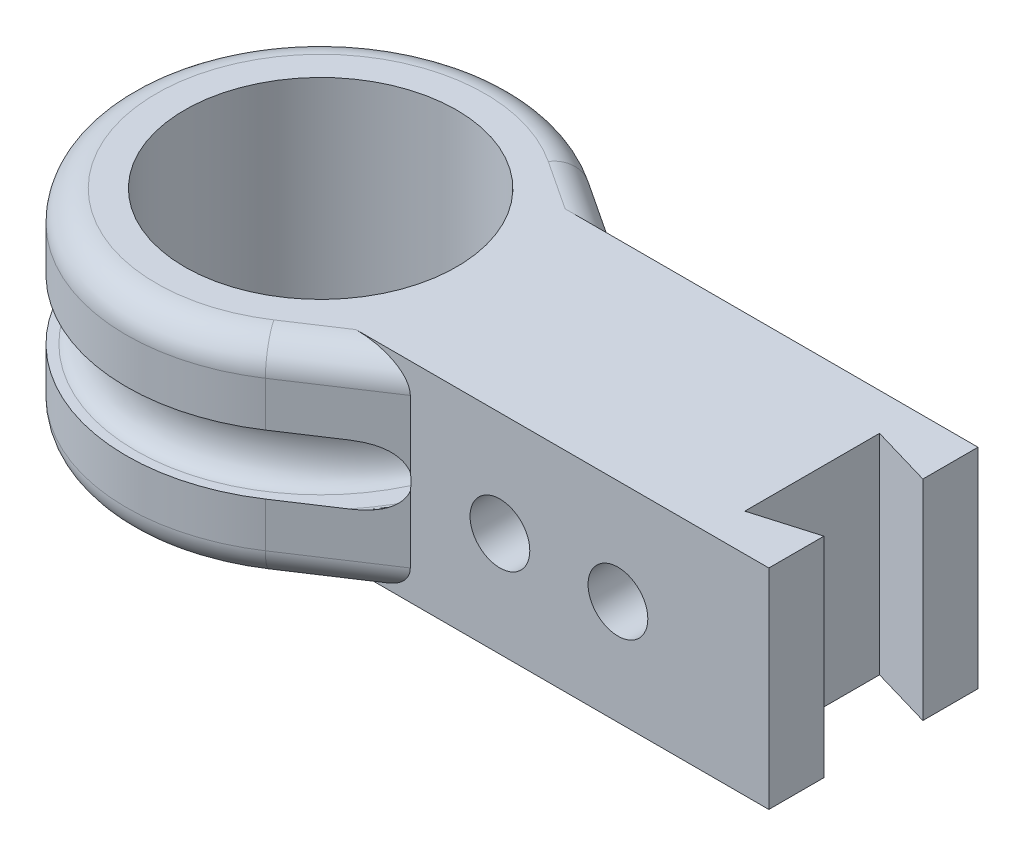
from build123d import *

# Parameters (mm, degrees)
SKETCH1_R           = 4.55
BOSS_EXTRUDE2_DEPTH = 7
CUT_EXTRUDE1_REACH  = 24.164
SKETCH3_R           = 1
FILLET4_R           = 1


with BuildPart() as part:
    # Sketch1 → Boss-Extrude2 (new body)
    with BuildSketch(Plane(origin=(0, 0, 0), x_dir=(1, 0, 0), z_dir=(0, 1, 0))):
        with BuildLine():
            Line((18.5, 3.5), (6.5, 3.5))
            Line((6.5, 3.5), (3.577981651, 5.426605505))
            ThreePointArc((3.577981651, 5.426605505), (-6.5, 0), (3.577981651, -5.426605505))
            Line((3.577981651, -5.426605505), (6.5, -3.5))
            Line((6.5, -3.5), (18.5, -3.5))
            Line((18.5, -3.5), (18.5, -1.655))
            Line((18.5, -1.655), (16.45, -2.255))
            Line((16.45, -2.255), (16.45, 2.255))
            Line((16.45, 2.255), (18.5, 1.655))
            Line((18.5, 1.655), (18.5, 3.5))
        make_face()
        Circle(SKETCH1_R, mode=Mode.SUBTRACT)
    extrude(amount=BOSS_EXTRUDE2_DEPTH)

    # Sketch2 → Cut-Revolve1 (revolve, cut)
    with BuildSketch(Plane(origin=(0, 0, 0), x_dir=(0, -1, 0), z_dir=(1, 0, 0))):
        with BuildLine():
            Line((-4.5, 6.805), (-4.5, 6.195))
            add(Edge.make_bspline(
                [(-4.5, 6.195), (-4.5, 5.595), (-3.5, 5.595), (-2.5, 5.595), (-2.5, 6.195)],
                knots=[0, 0, 0, 1.570796327, 1.570796327, 3.141592654, 3.141592654, 3.141592654], degree=2, weights=[1, 0.707106781, 1, 0.707106781, 1]))
            Line((-2.5, 6.195), (-2.5, 6.805))
            add(Edge.make_bspline(
                [(-2.5, 6.805), (-2.499999858, 7.405000085), (-3.5, 7.405000085), (-4.500000142, 7.405000085), (-4.5, 6.805)],
                knots=[3.141592512, 3.141592512, 3.141592512, 4.71238898, 4.71238898, 6.283185449, 6.283185449, 6.283185449], degree=2, weights=[1, 0.707106731, 1, 0.707106731, 1]))
        make_face()
    revolve(axis=Axis((0, 7.335318457, 0), (0, -1, 0)), mode=Mode.SUBTRACT)

    # Sketch3 → Cut-Extrude1 (cut, up to next)
    with BuildSketch(Plane.XY.offset(3.5), mode=Mode.PRIVATE) as cut_extrude1_sk1:
        with Locations((13.45, 3.5)):
            Circle(SKETCH3_R)
    cut_extrude1_tool1 = extrude(cut_extrude1_sk1.sketch, amount=-CUT_EXTRUDE1_REACH, mode=Mode.PRIVATE) & part.part
    # Sketch3 → Cut-Extrude1 (cut, up to next)
    with BuildSketch(Plane.XY.offset(3.5), mode=Mode.PRIVATE) as cut_extrude1_sk2:
        with Locations((9.5, 3.5)):
            Circle(SKETCH3_R)
    cut_extrude1_tool2 = extrude(cut_extrude1_sk2.sketch, amount=-CUT_EXTRUDE1_REACH, mode=Mode.PRIVATE) & part.part
    add(cut_extrude1_tool1.solids().sort_by_distance((13.45, 3.5, 3.5))[0], mode=Mode.SUBTRACT)
    add(cut_extrude1_tool2.solids().sort_by_distance((9.5, 3.5, 3.5))[0], mode=Mode.SUBTRACT)

    # Fillet4
    fillet4_edges = [part.edges().sort_by_distance(p)[0] for p in [
        (5.038990826, 0, -4.463302752),
        (5.038990826, 0, 4.463302752),
        (5.038990826, 7, -4.463302752),
        (5.038990826, 7, 4.463302752),
        (-6.5, 0, 0),
        (-6.5, 7, 0),
    ]]
    fillet(fillet4_edges, radius=FILLET4_R)


solid = part.part
